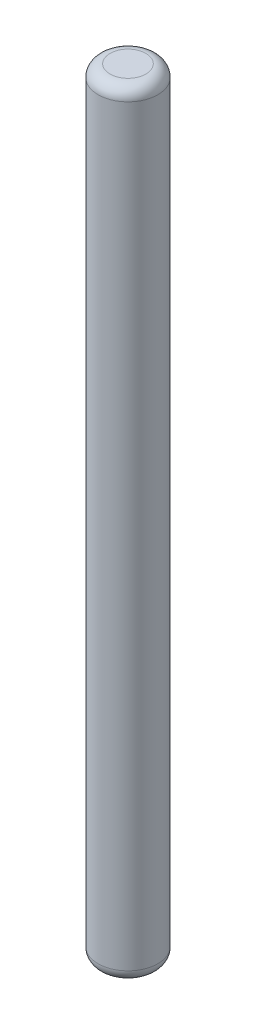
from build123d import *

# Parameters (mm, degrees)
SKETCH2_R           = 2.5
BOSS_EXTRUDE1_DEPTH = 65
CUT_EXTRUDE1_START  = -25
CUT_EXTRUDE1_DEPTH  = 25
FILLET1_R           = 1
FILLET2_R           = 1


with BuildPart() as part:
    # Sketch2 → Boss-Extrude1 (new body)
    with BuildSketch(Plane(origin=(0, 0, 0), x_dir=(1, 0, 0), z_dir=(0, 1, 0))):
        with Locations(Location((0.061061942, 0.061061942, 0), (0, 0, 270))):
            Circle(SKETCH2_R)
    extrude(amount=BOSS_EXTRUDE1_DEPTH)

    # Sketch3 → Cut-Extrude1 (cut)
    with BuildSketch(Plane(origin=(0, 65, 0), x_dir=(1, 0, 0), z_dir=(0, 1, 0)).offset(CUT_EXTRUDE1_START)):
        with BuildLine():
            Line((-1.00625914, 2.321775482), (1.173082806, 2.300126389))
            ThreePointArc((1.173082806, 2.300126389), (0.085895154, 2.560938601), (-1.00625914, 2.321775482))
        make_face()
    extrude(amount=CUT_EXTRUDE1_DEPTH, mode=Mode.SUBTRACT)

    # Fillet1
    # the kernel refuses this fillet: 1 mm, written as the material it takes off along each edge
    with BuildSketch(Plane(origin=(0.061061942, 65, -0.061061942), x_dir=(0.5312663336495629, 0, -0.8472048646759243), z_dir=(0.8472048646759243, 0, 0.5312663336495629))) as fillet1_piece_1:
        with BuildLine():
            CenterArc((2.5 - FILLET1_R, -FILLET1_R), FILLET1_R, 0, 90)
            Line((2.5 - FILLET1_R, 0), (2.5, 0))
            Line((2.5, 0), (2.5, -FILLET1_R))
        make_face()
    revolve(axis=Axis((0.061061942, 65, -0.061061942), (0, 1, 0)), revolution_arc=212.091055881, mode=Mode.SUBTRACT)
    with BuildSketch(Plane(origin=(0.061061942, 65, -0.061061942), x_dir=(0, 0, 1), z_dir=(-1, 0, 0))) as fillet1_piece_2:
        with BuildLine():
            CenterArc((2.5 - FILLET1_R, -FILLET1_R), FILLET1_R, 0, 90)
            Line((2.5 - FILLET1_R, 0), (2.5, 0))
            Line((2.5, 0), (2.5, -FILLET1_R))
        make_face()
    revolve(axis=Axis((0.061061942, 65, -0.061061942), (0, 1, 0)), revolution_arc=210.951767977, mode=Mode.SUBTRACT)

    # Fillet2
    fillet2_edges = [part.edges().sort_by_distance(p)[0] for p in [
        (0.061061942, 0, -2.561061942),
    ]]
    fillet(fillet2_edges, radius=FILLET2_R)


solid = part.part
